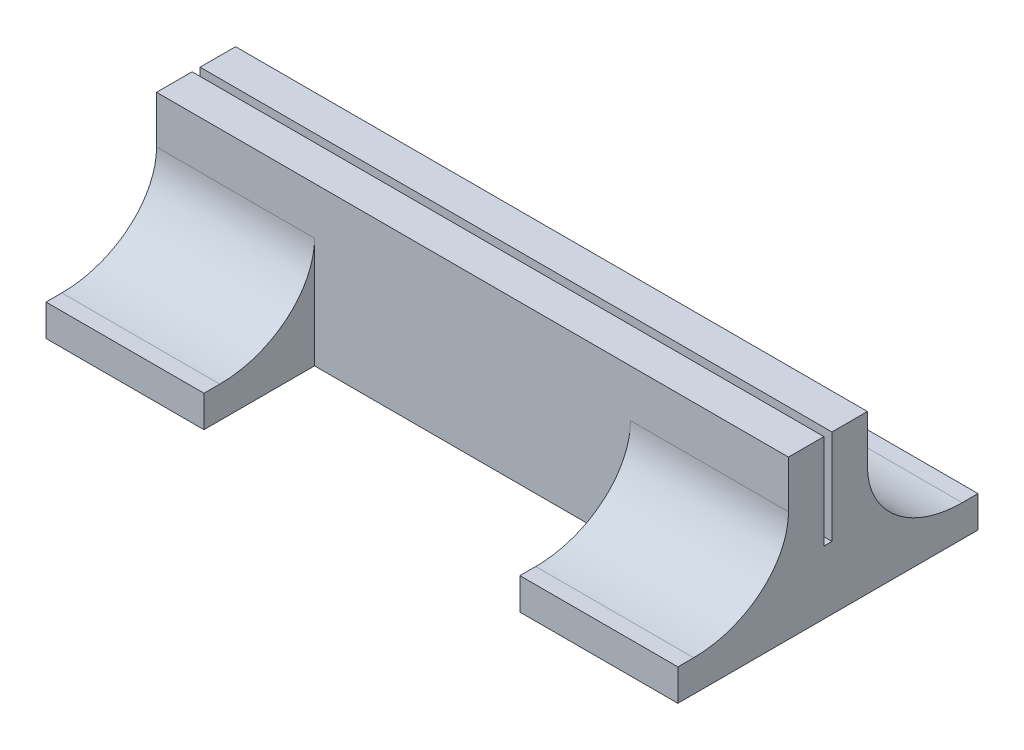
from build123d import *

# Parameters (mm, degrees)
ESQUISSE1_W             = 40
ESQUISSE1_H             = 5
BOSS_EXTRU_1_DEPTH      = 10
ESQUISSE2_W             = 40
ESQUISSE2_H             = 0.508359338
ENL_V_MAT_EXTRU_1_DEPTH = 6
BOSS_EXTRU_2_START      = -12
ESQUISSE3_W             = 10
ESQUISSE3_H             = 2
BOSS_EXTRU_2_DEPTH      = 19
CONG_1_SIZE             = 6
CONG_1_SIZE_2           = 5
CONG_2_SIZE             = 6
CONG_2_SIZE_2           = 5
CONG_4_SIZE             = 6
CONG_4_SIZE_2           = 5
CONG_5_SIZE             = 6
CONG_5_SIZE_2           = 5


with BuildPart() as part:
    # Esquisse1 → Boss.-Extru.1 (new body)
    with BuildSketch(Plane(origin=(0, 0, 0), x_dir=(1, 0, 0), z_dir=(0, 1, 0))):
        Rectangle(ESQUISSE1_W, ESQUISSE1_H)
    extrude(amount=BOSS_EXTRU_1_DEPTH)

    # Esquisse2 → Enlèv. mat.-Extru.1 (cut)
    with BuildSketch(Plane(origin=(0, 10, 0), x_dir=(1, 0, 0), z_dir=(0, 1, 0))):
        Rectangle(ESQUISSE2_W, ESQUISSE2_H)
    extrude(amount=-ENL_V_MAT_EXTRU_1_DEPTH, mode=Mode.SUBTRACT)

    # Esquisse3 → Boss.-Extru.2 (add)
    with BuildSketch(Plane.XY.offset(2.5).offset(BOSS_EXTRU_2_START)):
        with Locations((-15, 1)):
            Rectangle(ESQUISSE3_W, ESQUISSE3_H)
    boss_extru_2 = extrude(amount=BOSS_EXTRU_2_DEPTH)

    # Symétrie1: Boss.-Extru.2 across plane
    add(boss_extru_2.mirror(Plane(origin=(0, 0, 0), x_dir=(0, 0, 1), z_dir=(1, 0, 0))))

    # Congé1
    # an asymmetric fillet: 6, 5 mm, written as the material it adds along each edge
    with BuildSketch(Plane(origin=(-20, 2, 2.5), x_dir=(0, 0, 1), z_dir=(1, 0, 0))) as cong_1_piece_1:
        with BuildLine():
            Bezier((CONG_1_SIZE, 0), (0, 0), (0, -CONG_1_SIZE_2), weights=[1, 0.707106781, 1])
            Line((0, -CONG_1_SIZE_2), (0, 0))
            Line((0, 0), (CONG_1_SIZE, 0))
        make_face()
    extrude(amount=10)

    # Congé2
    # an asymmetric fillet: 6, 5 mm, written as the material it adds along each edge
    with BuildSketch(Plane(origin=(20, 2, 2.5), x_dir=(0, 0, 1), z_dir=(-1, 0, 0))) as cong_2_piece_1:
        with BuildLine():
            Bezier((CONG_2_SIZE, 0), (0, 0), (0, CONG_2_SIZE_2), weights=[1, 0.707106781, 1])
            Line((0, CONG_2_SIZE_2), (0, 0))
            Line((0, 0), (CONG_2_SIZE, 0))
        make_face()
    extrude(amount=10)

    # Congé4
    # an asymmetric fillet: 6, 5 mm, written as the material it adds along each edge
    with BuildSketch(Plane(origin=(10, 2, -2.5), x_dir=(0, 0, -1), z_dir=(1, 0, 0))) as cong_4_piece_1:
        with BuildLine():
            Bezier((CONG_4_SIZE, 0), (0, 0), (0, CONG_4_SIZE_2), weights=[1, 0.707106781, 1])
            Line((0, CONG_4_SIZE_2), (0, 0))
            Line((0, 0), (CONG_4_SIZE, 0))
        make_face()
    extrude(amount=10)

    # Congé5
    # an asymmetric fillet: 6, 5 mm, written as the material it adds along each edge
    with BuildSketch(Plane(origin=(-10, 2, -2.5), x_dir=(0, 0, -1), z_dir=(-1, 0, 0))) as cong_5_piece_1:
        with BuildLine():
            Bezier((CONG_5_SIZE, 0), (0, 0), (0, -CONG_5_SIZE_2), weights=[1, 0.707106781, 1])
            Line((0, -CONG_5_SIZE_2), (0, 0))
            Line((0, 0), (CONG_5_SIZE, 0))
        make_face()
    extrude(amount=10)


solid = part.part
